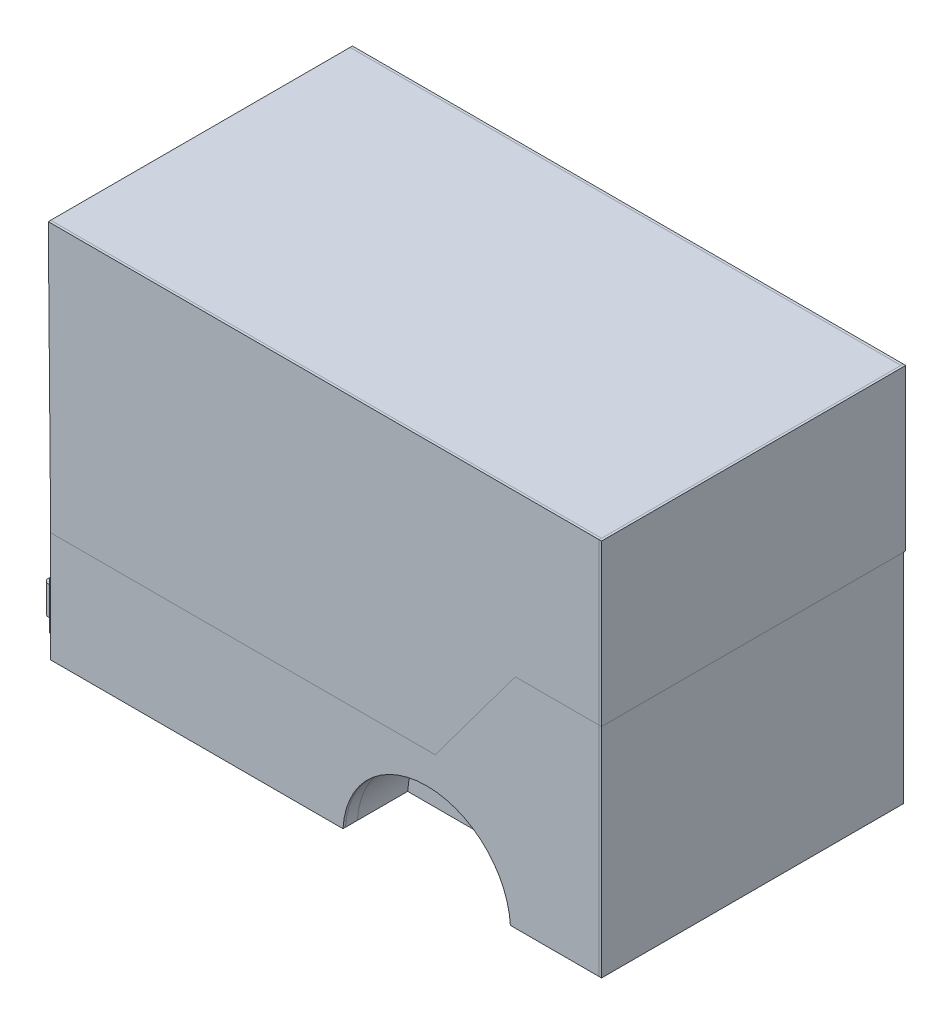
from build123d import *

# Parameters (mm, degrees)
SKETCH_1_W                = 229
SKETCH_1_H                = 125
EXTRUDE_1_DEPTH           = 88
SKETCH_4_W                = 125
SKETCH_4_H                = 88
SKETCH_4_W_2              = 123
SKETCH_4_H_2              = 86
CUT_EXTRUDE_3_DEPTH       = 1
SKETCH_5_W                = 125
SKETCH_5_H                = 88
EXTRUDE_2_DEPTH           = 1
SKETCH_11_W               = 5
SKETCH_11_H               = 20
EXTRUDE_3_DEPTH           = 2
SKETCH_12_R               = 2
EXTRUDE_4_DEPTH           = 12
SKETCH_13_R               = 35
CUT_EXTRUDE_7_DEPTH       = 26
CUT_EXTRUDE_START         = -26
SKETCH_14_R               = 35
CUT_EXTRUDE_8_DEPTH       = 26
SKETCH_16_W               = 229
SKETCH_16_H               = 125
EXTRUDE_6_DEPTH           = 70
SHELL_START               = -980.231317195
SHELL_1_OUTLINE_W         = 148
SHELL_1_OUTLINE_H         = 115
SHELL_1_DEPTH             = 113.617262665
SHELL_START_2             = -787.84857986
SHELL_1_2_OUTLINE_W       = 148
SHELL_1_2_OUTLINE_H       = 115
SHELL_1_2_DEPTH           = 31.617262665
SHELL_1_3_OUTLINE_W       = 3
SHELL_1_3_OUTLINE_H       = 63
SHELL_1_3_DEPTH           = 224
SHELL_START_3             = -981.231317195
SHELL_1_4_DEPTH           = 1
SHELL_START_4             = 7.020467364
SHELL_1_5_DEPTH           = 115
SHELL_START_5             = 33.020467364
SHELL_1_6_DEPTH           = 63
CUT_EXTRUDE_START_2       = -70
CUT_EXTRUDE_9_DEPTH       = 70
SKETCH_20_W               = 125
SKETCH_20_H               = 158
SKETCH_20_W_2             = 115
SKETCH_20_H_2             = 148
EXTRUDE_7_DEPTH           = 1
CUT_EXTRUDE_START_3       = -5
CUT_EXTRUDE_14_DEPTH      = 5
EXTRUDE_8_DEPTH           = 5
SKETCH_26_W               = 230
SKETCH_26_H               = 125
CUT_EXTRUDE_15_DEPTH      = 5
SKETCH_27_W               = 230
SKETCH_27_H               = 125
EXTRUDE_9_DEPTH           = 5
SKETCH_28_W               = 5
SKETCH_28_H               = 115
EXTRUDE_10_DEPTH          = 148
EXTRUDE_11_DEPTH          = 1
EXTRUDE_12_DEPTH          = 1
SKETCH_32_W               = 127
SKETCH_32_H               = 67.090624259
EXTRUDE_13_DEPTH          = 1
SKETCH_33_W               = 126
SKETCH_33_H               = 90.909375741
EXTRUDE_14_DEPTH          = 1
CUT_EXTRUDE_16_DEPTH      = 40
CUT_EXTRUDE_16_DEPTH_BACK = 10
SKETCH_34_W               = 225
SKETCH_34_H               = 5
SKETCH_35_W               = 220
SKETCH_35_H               = 153
EXTRUDE_16_DEPTH          = 5
SKETCH_36_W               = 5
SKETCH_36_H               = 153
EXTRUDE_17_DEPTH          = 5
CUT_EXTRUDE_17_DEPTH      = 5
SKETCH_39_W               = 115
SKETCH_39_H               = 5
CUT_EXTRUDE_18_DEPTH      = 5
SKETCH_40_W               = 5
SKETCH_40_H               = 120
EXTRUDE_19_DEPTH          = 153
SKETCH_45_W               = 78.76547467
SKETCH_45_H               = 26
EXTRUDE_21_DEPTH          = 33
CUT_EXTRUDE_20_DEPTH      = 21
SKETCH_48_R               = 34.912032086
CUT_EXTRUDE_21_DEPTH      = 21
SKETCH_49_W               = 106.382737335
SKETCH_49_H               = 26
EXTRUDE_22_DEPTH          = 40
SKETCH_50_W               = 78.76547467
SKETCH_50_H               = 33
CUT_EXTRUDE_23_DEPTH      = 26
SKETCH_52_W               = 20
SKETCH_52_H               = 20
EXTRUDE_23_DEPTH          = 55
SKETCH_53_W               = 106.382737335
SKETCH_53_H               = 53.625388161
EXTRUDE_24_DEPTH          = 5
SKETCH_54_W               = 100
SKETCH_54_H               = 56.25
EXTRUDE_25_DEPTH          = 1
SKETCH_55_W               = 110
SKETCH_55_H               = 66.25
SKETCH_55_W_2             = 100
SKETCH_55_H_2             = 56.25
EXTRUDE_26_DEPTH          = 2
SKETCH_58_W               = 20
SKETCH_58_H               = 20
EXTRUDE_28_DEPTH          = 70
FILLET_1_R                = 19
SKETCH_59_W               = 55
SKETCH_59_H               = 0.2
CUT_EXTRUDE_25_DEPTH      = 10
SKETCH_60_W               = 60
SKETCH_60_H               = 2
CUT_EXTRUDE_26_DEPTH      = 10
SKETCH_61_W               = 30
SKETCH_61_H               = 19
EXTRUDE_29_DEPTH          = 2
SKETCH_62_W               = 30
SKETCH_62_H               = 2
EXTRUDE_30_DEPTH          = 20
SKETCH_63_W               = 28
SKETCH_63_H               = 18
CUT_EXTRUDE_27_DEPTH      = 1
SKETCH_64_W               = 1.5
SKETCH_64_H               = 1.5
EXTRUDE_31_DEPTH          = 1
SKETCH_65_W               = 10
SKETCH_65_H               = 4.5
CUT_EXTRUDE_28_DEPTH      = 0.1
SKETCH_68_W               = 111.382737335
SKETCH_68_H               = 40
EXTRUDE_32_DEPTH          = 26
SKETCH_70_R               = 2.5
CUT_EXTRUDE_29_DEPTH      = 111.382737335
SKETCH_71_W               = 0.5
SKETCH_71_H               = 34.5
SKETCH_71_H_2             = 5.5
CUT_EXTRUDE_31_DEPTH      = 26
SKETCH_72_W               = 40
SKETCH_72_H               = 30
EXTRUDE_33_DEPTH          = 100
SKETCH_73_R               = 2
CUT_EXTRUDE_32_DEPTH      = 100
SKETCH_75_W               = 40
SKETCH_75_H               = 1
CUT_EXTRUDE_33_DEPTH      = 29
SKETCH_76_W               = 45
SKETCH_76_H               = 30
EXTRUDE_34_DEPTH          = 100
SKETCH_79_W               = 45
SKETCH_79_H               = 1
CUT_EXTRUDE_36_DEPTH      = 29
SKETCH_80_W               = 1
SKETCH_80_H               = 4
CUT_EXTRUDE_37_DEPTH      = 59
SKETCH_81_W               = 80
SKETCH_81_H               = 45
EXTRUDE_35_DEPTH          = 1
SKETCH_82_W               = 84
SKETCH_82_H               = 49
SKETCH_82_W_2             = 80
SKETCH_82_H_2             = 45
EXTRUDE_36_DEPTH          = 2


with BuildPart() as part:
    # 스케치1 → 보스-돌출1 (new body)
    with BuildSketch(Plane(origin=(0, 0, 0), x_dir=(1, 0, 0), z_dir=(0, 1, 0))):
        with Locations((-871.731317195, -64.520467364)):
            Rectangle(SKETCH_1_W, SKETCH_1_H)
    extrude(amount=EXTRUDE_1_DEPTH)

    # 스케치4 → 컷-돌출3 (cut)
    # profile 1 of 2: a face of its own
    with BuildSketch(Plane.ZY.offset(986.231317195)):
        with Locations((64.520467364, 44)):
            Rectangle(SKETCH_4_W, SKETCH_4_H)
        with Locations((64.520467364, 44)):
            Rectangle(SKETCH_4_W_2, SKETCH_4_H_2, mode=Mode.SUBTRACT)
    # profile 2 of 2: a face of its own
    with BuildSketch(Plane.ZY.offset(986.231317195)):
        with BuildLine():
            Line((6.020467364, 84), (6.020467364, 67.306026885))
            ThreePointArc((6.020467364, 67.306026885), (6.552613646, 56.95178287), (8.143444971, 46.70664722))
            Line((8.143444971, 46.70664722), (8.939528918, 42.885444272))
            ThreePointArc((8.939528918, 42.885444272), (10.498858633, 32.843182595), (11.020467364, 22.693973115))
            Line((11.020467364, 22.693973115), (11.020467364, 2))
            Line((11.020467364, 2), (118.020467364, 2))
            Line((118.020467364, 2), (118.020467364, 22.693973115))
            ThreePointArc((118.020467364, 22.693973115), (118.542076095, 32.843182595), (120.10140581, 42.885444272))
            Line((120.10140581, 42.885444272), (120.897489758, 46.70664722))
            ThreePointArc((120.897489758, 46.70664722), (122.488321083, 56.95178287), (123.020467364, 67.306026885))
            Line((123.020467364, 67.306026885), (123.020467364, 84))
            Line((123.020467364, 84), (6.020467364, 84))
        make_face()
        with BuildLine():
            Line((12.020467364, 22.693973115), (12.020467364, 3))
            Line((12.020467364, 3), (117.020467364, 3))
            Line((117.020467364, 3), (117.020467364, 22.693973115))
            ThreePointArc((117.020467364, 22.693973115), (117.547344871, 32.945699863), (119.122425391, 43.089398526))
            Line((119.122425391, 43.089398526), (119.918509338, 46.910601474))
            ThreePointArc((119.918509338, 46.910601474), (121.493589858, 57.054300137), (122.020467364, 67.306026885))
            Line((122.020467364, 67.306026885), (122.020467364, 83))
            Line((122.020467364, 83), (7.020467364, 83))
            Line((7.020467364, 83), (7.020467364, 67.306026885))
            ThreePointArc((7.020467364, 67.306026885), (7.547344871, 57.054300137), (9.122425391, 46.910601474))
            Line((9.122425391, 46.910601474), (9.918509338, 43.089398526))
            ThreePointArc((9.918509338, 43.089398526), (11.493589858, 32.945699863), (12.020467364, 22.693973115))
        make_face(mode=Mode.SUBTRACT)
    extrude(amount=-CUT_EXTRUDE_3_DEPTH, mode=Mode.SUBTRACT)

    # 스케치5 → 보스-돌출2 (add)
    with BuildSketch(Plane(origin=(-757.231317195, 0, 0), x_dir=(0, 0, -1), z_dir=(1, 0, 0))):
        with Locations((-64.520467364, 44)):
            Rectangle(SKETCH_5_W, SKETCH_5_H)
    extrude(amount=EXTRUDE_2_DEPTH)

    # 스케치13 → 컷-돌출7 (cut)
    with BuildSketch(Plane.XY.offset(127.020467364)):
        with Locations((-827.231317195, -2)):
            Circle(SKETCH_13_R)
    extrude(amount=-CUT_EXTRUDE_7_DEPTH, mode=Mode.SUBTRACT)

    # 스케치14 → 컷-돌출8 (cut)
    with BuildSketch(Plane(origin=(0, 0, 2.020467364), x_dir=(-1, 0, 0), z_dir=(0, 0, -1)).offset(CUT_EXTRUDE_START)):
        with Locations((827.231317195, -2)):
            Circle(SKETCH_14_R)
    extrude(amount=CUT_EXTRUDE_8_DEPTH, mode=Mode.SUBTRACT)

    # 스케치16 → 보스-돌출6 (add)
    with BuildSketch(Plane(origin=(0, 88, 0), x_dir=(1, 0, 0), z_dir=(0, 1, 0))):
        with Locations((-870.731317195, -64.520467364)):
            Rectangle(SKETCH_16_W, SKETCH_16_H)
    extrude(amount=EXTRUDE_6_DEPTH)

    # 쉘1: read off the stored shape, not the designer's step
    # 쉘1 outline → 쉘1 (cut)
    with BuildSketch(Plane.YZ.offset(SHELL_START)):
        with Locations((79, 64.520467364)):
            Rectangle(SHELL_1_OUTLINE_W, SHELL_1_OUTLINE_H)
    extrude(amount=SHELL_1_DEPTH, mode=Mode.SUBTRACT)

    # Shell 1 2 outline → Shell 1 2 (cut)
    with BuildSketch(Plane.YZ.offset(SHELL_START_2)):
        with Locations((79, 64.520467364)):
            Rectangle(SHELL_1_2_OUTLINE_W, SHELL_1_2_OUTLINE_H)
    extrude(amount=SHELL_1_2_DEPTH, mode=Mode.SUBTRACT)

    # Shell 1 3 outline → Shell 1 3 (cut)
    with BuildSketch(Plane.YZ.offset(SHELL_START)):
        with Locations((6.5, 64.520467364)):
            Rectangle(SHELL_1_3_OUTLINE_W, SHELL_1_3_OUTLINE_H)
    extrude(amount=SHELL_1_3_DEPTH, mode=Mode.SUBTRACT)

    # Shell 1 4 outline → Shell 1 4 (cut)
    with BuildSketch(Plane.YZ.offset(SHELL_START_3)):
        with BuildLine():
            Line((8, 96.020467364), (8, 33.020467364))
            Line((8, 33.020467364), (8, 17.020467364))
            Line((8, 17.020467364), (22.693973115, 17.020467364))
            ThreePointArc((22.693973115, 17.020467364), (33.4582862, 16.467245983), (44.109169797, 14.813411437))
            Line((44.109169797, 14.813411437), (47.930372745, 14.017327489))
            ThreePointArc((47.930372745, 14.017327489), (57.566886475, 12.521000995), (67.306026885, 12.020467364))
            Line((67.306026885, 12.020467364), (78, 12.020467364))
            Line((78, 12.020467364), (78, 117.020467364))
            Line((78, 117.020467364), (67.306026885, 117.020467364))
            ThreePointArc((67.306026885, 117.020467364), (57.566886475, 116.519933734), (47.930372745, 115.023607239))
            Line((47.930372745, 115.023607239), (44.109169797, 114.227523292))
            ThreePointArc((44.109169797, 114.227523292), (33.4582862, 112.573688746), (22.693973115, 112.020467364))
            Line((22.693973115, 112.020467364), (8, 112.020467364))
            Line((8, 112.020467364), (8, 96.020467364))
        make_face()
    extrude(amount=SHELL_1_4_DEPTH, mode=Mode.SUBTRACT)

    # Shell 1 5 outline → Shell 1 5 (cut)
    with BuildSketch(Plane.XY.offset(SHELL_START_4)):
        with BuildLine():
            Line((-787.84857986, 5), (-787.84857986, 153))
            Line((-787.84857986, 153), (-866.61405453, 153))
            Line((-866.61405453, 153), (-866.61405453, 5))
            ThreePointArc((-866.61405453, 5), (-827.231317195, 38), (-787.84857986, 5))
        make_face()
    extrude(amount=SHELL_1_5_DEPTH, mode=Mode.SUBTRACT)

    # Shell 1 6 outline → Shell 1 6 (cut)
    with BuildSketch(Plane.XY.offset(SHELL_START_5)):
        with BuildLine():
            Line((-865.961150657, 8), (-788.501483733, 8))
            ThreePointArc((-788.501483733, 8), (-827.231317195, 38), (-865.961150657, 8))
        make_face()
    extrude(amount=SHELL_1_6_DEPTH, mode=Mode.SUBTRACT)

    # 스케치18 → 컷-돌출9 (cut)
    with BuildSketch(Plane(origin=(-981.231317195, 0, 0), x_dir=(0, 0, -1), z_dir=(1, 0, 0)).offset(CUT_EXTRUDE_START_2)):
        with BuildLine():
            Line((-17.020467364, 8), (-17.020467364, 22.693973115))
            ThreePointArc((-17.020467364, 22.693973115), (-16.467245983, 33.4582862), (-14.813411437, 44.109169797))
            Line((-14.813411437, 44.109169797), (-14.017327489, 47.930372745))
            ThreePointArc((-14.017327489, 47.930372745), (-12.521000995, 57.566886475), (-12.020467364, 67.306026885))
            Line((-12.020467364, 67.306026885), (-12.020467364, 78))
            Line((-12.020467364, 78), (-117.020467364, 78))
            Line((-117.020467364, 78), (-117.020467364, 67.306026885))
            ThreePointArc((-117.020467364, 67.306026885), (-116.519933734, 57.566886475), (-115.023607239, 47.930372745))
            Line((-115.023607239, 47.930372745), (-114.227523292, 44.109169797))
            ThreePointArc((-114.227523292, 44.109169797), (-112.573688746, 33.4582862), (-112.020467364, 22.693973115))
            Line((-112.020467364, 22.693973115), (-112.020467364, 8))
            Line((-112.020467364, 8), (-17.020467364, 8))
        make_face()
    extrude(amount=CUT_EXTRUDE_9_DEPTH, mode=Mode.SUBTRACT)

    # 스케치20 → 보스-돌출7 (add)
    with BuildSketch(Plane(origin=(-756.231317195, 0, 0), x_dir=(0, 0, -1), z_dir=(1, 0, 0))):
        with Locations((-64.520467364, 79)):
            Rectangle(SKETCH_20_W, SKETCH_20_H)
        with Locations((-64.520467364, 79)):
            Rectangle(SKETCH_20_W_2, SKETCH_20_H_2, mode=Mode.SUBTRACT)
    extrude(amount=EXTRUDE_7_DEPTH)

    # 스케치24 → 컷-돌출14 (cut)
    with BuildSketch(Plane.XY.offset(127.020467364).offset(CUT_EXTRUDE_START_3)):
        with BuildLine():
            Line((-755.231317195, 153), (-980.231317195, 153))
            Line((-980.231317195, 153), (-980.231317195, 5))
            Line((-980.231317195, 5), (-866.61405453, 5))
            ThreePointArc((-866.61405453, 5), (-827.231317195, 38), (-787.84857986, 5))
            Line((-787.84857986, 5), (-755.231317195, 5))
            Line((-755.231317195, 5), (-755.231317195, 153))
        make_face()
    extrude(amount=CUT_EXTRUDE_14_DEPTH, mode=Mode.SUBTRACT)

    # 스케치26 → 컷-돌출15 (cut)
    with BuildSketch(Plane(origin=(0, 158, 0), x_dir=(1, 0, 0), z_dir=(0, 1, 0))):
        with Locations((-870.231317195, -64.520467364)):
            Rectangle(SKETCH_26_W, SKETCH_26_H)
    extrude(amount=-CUT_EXTRUDE_15_DEPTH, mode=Mode.SUBTRACT)

    # 스케치34 → 컷-돌출16 (cut, two sides: drawn at the far end of the back side and taken through both)
    with BuildSketch(Plane(origin=(0, 5, 0), x_dir=(1, 0, 0), z_dir=(0, 1, 0)).offset(-CUT_EXTRUDE_16_DEPTH_BACK)):
        with Locations((-867.731317195, -124.520467364)):
            Rectangle(SKETCH_34_W, SKETCH_34_H)
    extrude(amount=CUT_EXTRUDE_16_DEPTH + CUT_EXTRUDE_16_DEPTH_BACK, mode=Mode.SUBTRACT)

    # 스케치39 → 컷-돌출18 (cut)
    with BuildSketch(Plane(origin=(-755.231317195, 0, 0), x_dir=(0, 0, -1), z_dir=(1, 0, 0))):
        with Locations((-64.520467364, 2.5)):
            Rectangle(SKETCH_39_W, SKETCH_39_H)
    extrude(amount=-CUT_EXTRUDE_18_DEPTH, mode=Mode.SUBTRACT)

    # 스케치45 → 보스-돌출21 (add)
    with BuildSketch(Plane(origin=(0, 5, 0), x_dir=(1, 0, 0), z_dir=(0, 1, 0))):
        with Locations((-827.231317195, -20.020467364)):
            Rectangle(SKETCH_45_W, SKETCH_45_H)
        with Locations((-827.231317195, -109.020467364)):
            Rectangle(SKETCH_45_W, SKETCH_45_H)
    extrude(amount=EXTRUDE_21_DEPTH)

    # 스케치47 → 컷-돌출20 (cut)
    with BuildSketch(Plane.XY.offset(122.020467364)):
        with BuildLine():
            Line((-862.174127614, 0), (-792.288506775, 0))
            ThreePointArc((-792.288506775, 0), (-827.231317195, 33), (-862.174127614, 0))
        make_face()
    extrude(amount=-CUT_EXTRUDE_20_DEPTH, mode=Mode.SUBTRACT)

    # 스케치48 → 컷-돌출21 (cut)
    with BuildSketch(Plane(origin=(0, 0, 7.020467364), x_dir=(-1, 0, 0), z_dir=(0, 0, -1))):
        with Locations((827.252311569, -1.914574066)):
            Circle(SKETCH_48_R)
    extrude(amount=-CUT_EXTRUDE_21_DEPTH, mode=Mode.SUBTRACT)


with BuildPart() as body_2:
    # 스케치11 → 보스-돌출3 (new body)
    with BuildSketch(Plane.ZY.offset(986.231317195)):
        with Locations((122.020467364, 16)):
            Rectangle(SKETCH_11_W, SKETCH_11_H)
    extrude(amount=EXTRUDE_3_DEPTH)

    # 스케치12 → 보스-돌출4 (add)
    with BuildSketch(Plane(origin=(0, 23, 0), x_dir=(1, 0, 0), z_dir=(0, 1, 0))):
        with Locations((-989.231317195, -122.020467364)):
            Circle(SKETCH_12_R)
    extrude(amount=-EXTRUDE_4_DEPTH)


with BuildPart() as body_3:
    # 대칭 복사1: mirrored copy
    add(body_2.part.mirror(Plane.XY.offset(64.520467364)))


with BuildPart() as body_4:
    # 스케치25 → 보스-돌출8 (new body)
    with BuildSketch(Plane.XY.offset(127.020467364)):
        with BuildLine():
            Line((-980.231317195, 153), (-755.231317195, 153))
            Line((-755.231317195, 153), (-755.231317195, 5))
            Line((-755.231317195, 5), (-787.616277727, 5))
            ThreePointArc((-787.616277727, 5), (-826.999015062, 38), (-866.381752397, 5))
            Line((-866.381752397, 5), (-980.231317195, 5))
            Line((-980.231317195, 5), (-980.231317195, 153))
        make_face()
    extrude(amount=-EXTRUDE_8_DEPTH)


with BuildPart() as body_5:
    # 스케치27 → 보스-돌출9 (new body)
    with BuildSketch(Plane(origin=(0, 153, 0), x_dir=(1, 0, 0), z_dir=(0, 1, 0))):
        with Locations((-870.231317195, -64.520467364)):
            Rectangle(SKETCH_27_W, SKETCH_27_H)
    extrude(amount=EXTRUDE_9_DEPTH)


with BuildPart() as body_6:
    # 스케치28 → 보스-돌출10 (new body)
    with BuildSketch(Plane(origin=(0, 5, 0), x_dir=(1, 0, 0), z_dir=(0, 1, 0))):
        with Locations((-757.731317195, -64.520467364)):
            Rectangle(SKETCH_28_W, SKETCH_28_H)
    extrude(amount=EXTRUDE_10_DEPTH)


with BuildPart() as body_7:
    # 스케치29 → 보스-돌출11 (new body)
    with BuildSketch(Plane(origin=(0, 0, 2.020467364), x_dir=(-1, 0, 0), z_dir=(0, 0, -1))):
        with BuildLine():
            Line((984.231317195, 0), (984.231317195, 46))
            Line((984.231317195, 46), (823.655113572, 46))
            Line((823.655113572, 46), (790.231317195, 90.909375741))
            Line((790.231317195, 90.909375741), (755.231317195, 90.909375741))
            Line((755.231317195, 90.909375741), (755.231317195, 0))
            Line((755.231317195, 0), (792.288506775, 0))
            ThreePointArc((792.288506775, 0), (827.231317195, 33), (862.174127614, 0))
            Line((862.174127614, 0), (984.231317195, 0))
        make_face()
    extrude(amount=EXTRUDE_11_DEPTH)


with BuildPart() as body_8:
    # 스케치30 → 보스-돌출12 (new body)
    with BuildSketch(Plane(origin=(0, 0, 2.020467364), x_dir=(-1, 0, 0), z_dir=(0, 0, -1))):
        Polygon((755.231317195, 90.909375741), (755.231317195, 158), (985.231317195, 158), (984.231317195, 46), (823.655113572, 46), (790.231317195, 90.909375741), align=None)
    extrude(amount=EXTRUDE_12_DEPTH)


with BuildPart() as body_8_2:
    # 대칭 복사3: mirrored copy
    add(body_8.part.mirror(Plane.XY.offset(64.520467364)))


with BuildPart() as body_9:
    # Mirror 3 2: mirrored copy
    add(body_7.part.mirror(Plane.XY.offset(64.520467364)))


with BuildPart() as body_10:
    # 스케치32 → 보스-돌출13 (new body)
    with BuildSketch(Plane(origin=(-755.231317195, 0, 0), x_dir=(0, 0, -1), z_dir=(1, 0, 0))):
        with Locations((-64.520467364, 124.454687871)):
            Rectangle(SKETCH_32_W, SKETCH_32_H)
    extrude(amount=EXTRUDE_13_DEPTH)


with BuildPart() as body_11:
    # 스케치33 → 보스-돌출14 (new body)
    with BuildSketch(Plane(origin=(-755.231317195, 0, 0), x_dir=(0, 0, -1), z_dir=(1, 0, 0))):
        with Locations((-65.020467364, 45.454687871)):
            Rectangle(SKETCH_33_W, SKETCH_33_H)
    extrude(amount=EXTRUDE_14_DEPTH)


with BuildPart() as body_12:
    # 대칭 복사4: mirrored copy
    add(body_2.part.mirror(Plane.XY.offset(64.520467364)))


with BuildPart() as body_12_2:
    # 스케치35 → 보스-돌출16 (new body)
    with BuildSketch(Plane.XY.offset(122.020467364)):
        with Locations((-870.231317195, 76.5)):
            Rectangle(SKETCH_35_W, SKETCH_35_H)
    extrude(amount=EXTRUDE_16_DEPTH)

    # 스케치36 → 보스-돌출17 (add)
    with BuildSketch(Plane(origin=(-760.231317195, 0, 0), x_dir=(0, 0, -1), z_dir=(1, 0, 0))):
        with Locations((-124.520467364, 76.5)):
            Rectangle(SKETCH_36_W, SKETCH_36_H)
    extrude(amount=EXTRUDE_17_DEPTH)

    # 스케치37 → 컷-돌출17 (cut)
    with BuildSketch(Plane.XY.offset(127.020467364)):
        with BuildLine():
            Line((-862.174127614, 0), (-792.288506775, 0))
            ThreePointArc((-792.288506775, 0), (-827.231317195, 33), (-862.174127614, 0))
        make_face()
    extrude(amount=-CUT_EXTRUDE_17_DEPTH, mode=Mode.SUBTRACT)


with BuildPart() as body_12_3:
    # 스케치40 → 보스-돌출19 (new body)
    with BuildSketch(Plane.XZ):
        with Locations((-757.731317195, 67.020467364)):
            Rectangle(SKETCH_40_W, SKETCH_40_H)
    extrude(amount=-EXTRUDE_19_DEPTH)


with BuildPart() as body_13:
    # 스케치49 → 보스-돌출22 (new body)
    with BuildSketch(Plane(origin=(0, 5, 0), x_dir=(1, 0, 0), z_dir=(0, 1, 0))):
        with Locations((-813.422685863, -109.020467364)):
            Rectangle(SKETCH_49_W, SKETCH_49_H)
    extrude(amount=EXTRUDE_22_DEPTH)

    # 스케치50 → 컷-돌출23 (cut)
    with BuildSketch(Plane.XY.offset(122.020467364)):
        with Locations((-827.231317195, 21.5)):
            Rectangle(SKETCH_50_W, SKETCH_50_H)
    extrude(amount=-CUT_EXTRUDE_23_DEPTH, mode=Mode.SUBTRACT)


with BuildPart() as body_14:
    # 대칭 복사5: mirrored copy
    add(body_13.part.mirror(Plane.XY.offset(64.520467364)))


with BuildPart() as body_15:
    # 스케치52 → 보스-돌출23 (new body)
    with BuildSketch(Plane(origin=(0, 5, 0), x_dir=(1, 0, 0), z_dir=(0, 1, 0))):
        with Locations((-813.422685862, -64.520467364)):
            Rectangle(SKETCH_52_W, SKETCH_52_H)
    extrude(amount=EXTRUDE_23_DEPTH)

    # 스케치53 → 보스-돌출24 (add)
    with BuildSketch(Plane(origin=(0, 60, 0), x_dir=(1, 0, 0), z_dir=(0, 1, 0))):
        with Locations((-813.422685863, -64.520467365)):
            Rectangle(SKETCH_53_W, SKETCH_53_H)
    extrude(amount=EXTRUDE_24_DEPTH)


with BuildPart() as body_16:
    # 스케치54 → 보스-돌출25 (new body)
    with BuildSketch(Plane(origin=(-980.231317195, 0, 0), x_dir=(0, 0, -1), z_dir=(1, 0, 0))):
        with Locations((-67.020467364, 115.5)):
            Rectangle(SKETCH_54_W, SKETCH_54_H)
    extrude(amount=EXTRUDE_25_DEPTH)


with BuildPart() as body_17:
    # 스케치55 → 보스-돌출26 (new body)
    with BuildSketch(Plane(origin=(-979.231317195, 0, 0), x_dir=(0, 0, -1), z_dir=(1, 0, 0))):
        with Locations((-67.020467364, 115.5)):
            Rectangle(SKETCH_55_W, SKETCH_55_H)
        with Locations((-67.020467364, 115.5)):
            Rectangle(SKETCH_55_W_2, SKETCH_55_H_2, mode=Mode.SUBTRACT)
    extrude(amount=EXTRUDE_26_DEPTH)


with BuildPart() as body_18:
    # 스케치58 → 보스-돌출28 (new body)
    with BuildSketch(Plane(origin=(-972.231317195, 0, 0), x_dir=(0, 0, -1), z_dir=(1, 0, 0))):
        with Locations((-17.020467364, 134.236109848)):
            Rectangle(SKETCH_58_W, SKETCH_58_H)
    extrude(amount=EXTRUDE_28_DEPTH)

    # 필렛1
    fillet_1_edges = [body_18.edges().sort_by_distance(p)[0] for p in [
        (-937.231317195, 124.236109848, 27.020467364),
    ]]
    fillet(fillet_1_edges, radius=FILLET_1_R)

    # 스케치59 → 컷-돌출25 (cut)
    with BuildSketch(Plane.XZ.offset(-124.236109848)):
        with Locations((-942.231317195, 8.765783167)):
            Rectangle(SKETCH_59_W, SKETCH_59_H)
        with Locations((-942.231317195, 9.065783167)):
            Rectangle(SKETCH_59_W, SKETCH_59_H)
        with Locations((-942.231317195, 9.365783167)):
            Rectangle(SKETCH_59_W, SKETCH_59_H)
        with Locations((-942.231317195, 9.665783167)):
            Rectangle(SKETCH_59_W, SKETCH_59_H)
        with Locations((-942.231317195, 9.965783167)):
            Rectangle(SKETCH_59_W, SKETCH_59_H)
        with Locations((-942.231317195, 10.265783167)):
            Rectangle(SKETCH_59_W, SKETCH_59_H)
        with Locations((-942.231317195, 10.565783167)):
            Rectangle(SKETCH_59_W, SKETCH_59_H)
        with Locations((-942.231317195, 10.865783167)):
            Rectangle(SKETCH_59_W, SKETCH_59_H)
        with Locations((-942.231317195, 11.165783167)):
            Rectangle(SKETCH_59_W, SKETCH_59_H)
        with Locations((-942.231317195, 11.465783167)):
            Rectangle(SKETCH_59_W, SKETCH_59_H)
        with Locations((-942.231317195, 11.765783167)):
            Rectangle(SKETCH_59_W, SKETCH_59_H)
        with Locations((-942.231317195, 12.065783167)):
            Rectangle(SKETCH_59_W, SKETCH_59_H)
        with Locations((-942.231317195, 12.365783167)):
            Rectangle(SKETCH_59_W, SKETCH_59_H)
        with Locations((-942.231317195, 12.665783167)):
            Rectangle(SKETCH_59_W, SKETCH_59_H)
        with Locations((-942.231317195, 12.965783167)):
            Rectangle(SKETCH_59_W, SKETCH_59_H)
        with Locations((-942.231317195, 13.265783167)):
            Rectangle(SKETCH_59_W, SKETCH_59_H)
        with Locations((-942.231317195, 13.565783167)):
            Rectangle(SKETCH_59_W, SKETCH_59_H)
        with Locations((-942.231317195, 13.865783167)):
            Rectangle(SKETCH_59_W, SKETCH_59_H)
        with Locations((-942.231317195, 14.165783167)):
            Rectangle(SKETCH_59_W, SKETCH_59_H)
        with Locations((-942.231317195, 14.465783167)):
            Rectangle(SKETCH_59_W, SKETCH_59_H)
        with Locations((-942.231317195, 14.765783167)):
            Rectangle(SKETCH_59_W, SKETCH_59_H)
        with Locations((-942.231317195, 15.065783167)):
            Rectangle(SKETCH_59_W, SKETCH_59_H)
        with Locations((-942.231317195, 15.365783167)):
            Rectangle(SKETCH_59_W, SKETCH_59_H)
        with Locations((-942.231317195, 15.665783167)):
            Rectangle(SKETCH_59_W, SKETCH_59_H)
        with Locations((-942.231317195, 15.965783167)):
            Rectangle(SKETCH_59_W, SKETCH_59_H)
        with Locations((-942.231317195, 16.265783167)):
            Rectangle(SKETCH_59_W, SKETCH_59_H)
        with Locations((-942.231317195, 16.565783167)):
            Rectangle(SKETCH_59_W, SKETCH_59_H)
        with Locations((-942.231317195, 16.865783167)):
            Rectangle(SKETCH_59_W, SKETCH_59_H)
        with Locations((-942.231317195, 17.165783167)):
            Rectangle(SKETCH_59_W, SKETCH_59_H)
        with Locations((-942.231317195, 17.465783167)):
            Rectangle(SKETCH_59_W, SKETCH_59_H)
        with Locations((-942.231317195, 17.765783167)):
            Rectangle(SKETCH_59_W, SKETCH_59_H)
        with Locations((-942.231317195, 18.065783167)):
            Rectangle(SKETCH_59_W, SKETCH_59_H)
        with Locations((-942.231317195, 18.365783167)):
            Rectangle(SKETCH_59_W, SKETCH_59_H)
        with Locations((-942.231317195, 18.665783167)):
            Rectangle(SKETCH_59_W, SKETCH_59_H)
        with Locations((-942.231317195, 18.965783167)):
            Rectangle(SKETCH_59_W, SKETCH_59_H)
        with Locations((-942.231317195, 19.265783167)):
            Rectangle(SKETCH_59_W, SKETCH_59_H)
        with Locations((-942.231317195, 19.565783167)):
            Rectangle(SKETCH_59_W, SKETCH_59_H)
        with Locations((-942.231317195, 19.865783167)):
            Rectangle(SKETCH_59_W, SKETCH_59_H)
        with Locations((-942.231317195, 20.165783167)):
            Rectangle(SKETCH_59_W, SKETCH_59_H)
        with Locations((-942.231317195, 20.465783167)):
            Rectangle(SKETCH_59_W, SKETCH_59_H)
    extrude(amount=-CUT_EXTRUDE_25_DEPTH, mode=Mode.SUBTRACT)

    # 스케치60 → 컷-돌출26 (cut)
    with BuildSketch(Plane(origin=(0, 144.236109848, 0), x_dir=(1, 0, 0), z_dir=(0, 1, 0))):
        with Locations((-937.231317195, -10.168549835)):
            Rectangle(SKETCH_60_W, SKETCH_60_H)
        with Locations((-937.231317195, -13.168549835)):
            Rectangle(SKETCH_60_W, SKETCH_60_H)
        with Locations((-937.231317195, -16.168549835)):
            Rectangle(SKETCH_60_W, SKETCH_60_H)
        with Locations((-937.231317195, -19.168549835)):
            Rectangle(SKETCH_60_W, SKETCH_60_H)
    extrude(amount=-CUT_EXTRUDE_26_DEPTH, mode=Mode.SUBTRACT)


with BuildPart() as body_19:
    # 스케치61 → 보스-돌출29 (new body)
    with BuildSketch(Plane(origin=(0, 65, 0), x_dir=(1, 0, 0), z_dir=(0, 1, 0))):
        with Locations((-841.61405453, -77.234878482)):
            Rectangle(SKETCH_61_W, SKETCH_61_H)
    extrude(amount=EXTRUDE_29_DEPTH)

    # 스케치62 → 보스-돌출30 (add)
    with BuildSketch(Plane(origin=(0, 67, 0), x_dir=(1, 0, 0), z_dir=(0, 1, 0))):
        with Locations((-841.61405453, -68.734878482)):
            Rectangle(SKETCH_62_W, SKETCH_62_H)
    extrude(amount=EXTRUDE_30_DEPTH)

    # 스케치63 → 컷-돌출27 (cut)
    with BuildSketch(Plane.XY.offset(69.734878482)):
        with Locations((-841.61405453, 77)):
            Rectangle(SKETCH_63_W, SKETCH_63_H)
    extrude(amount=-CUT_EXTRUDE_27_DEPTH, mode=Mode.SUBTRACT)

    # 스케치64 → 보스-돌출31 (add)
    with BuildSketch(Plane(origin=(0, 67, 0), x_dir=(1, 0, 0), z_dir=(0, 1, 0))):
        with Locations((-853.86405453, -74.046732329)):
            Rectangle(SKETCH_64_W, SKETCH_64_H)
        with Locations((-851.86405453, -74.046732329)):
            Rectangle(SKETCH_64_W, SKETCH_64_H)
        with Locations((-849.86405453, -74.046732329)):
            Rectangle(SKETCH_64_W, SKETCH_64_H)
        with Locations((-847.86405453, -74.046732329)):
            Rectangle(SKETCH_64_W, SKETCH_64_H)
        with Locations((-845.86405453, -74.046732329)):
            Rectangle(SKETCH_64_W, SKETCH_64_H)
        with Locations((-843.86405453, -74.046732329)):
            Rectangle(SKETCH_64_W, SKETCH_64_H)
        with Locations((-841.86405453, -74.046732329)):
            Rectangle(SKETCH_64_W, SKETCH_64_H)
        with Locations((-839.86405453, -74.046732329)):
            Rectangle(SKETCH_64_W, SKETCH_64_H)
        with Locations((-837.86405453, -74.046732329)):
            Rectangle(SKETCH_64_W, SKETCH_64_H)
        with Locations((-835.86405453, -74.046732329)):
            Rectangle(SKETCH_64_W, SKETCH_64_H)
        with Locations((-833.86405453, -74.046732329)):
            Rectangle(SKETCH_64_W, SKETCH_64_H)
        with Locations((-831.86405453, -74.046732329)):
            Rectangle(SKETCH_64_W, SKETCH_64_H)
        with Locations((-829.86405453, -74.046732329)):
            Rectangle(SKETCH_64_W, SKETCH_64_H)
        with Locations((-850.86405453, -76.046732329)):
            Rectangle(SKETCH_64_W, SKETCH_64_H)
        with Locations((-852.86405453, -76.046732329)):
            Rectangle(SKETCH_64_W, SKETCH_64_H)
        with Locations((-848.86405453, -76.046732329)):
            Rectangle(SKETCH_64_W, SKETCH_64_H)
        with Locations((-846.86405453, -76.046732329)):
            Rectangle(SKETCH_64_W, SKETCH_64_H)
        with Locations((-844.86405453, -76.046732329)):
            Rectangle(SKETCH_64_W, SKETCH_64_H)
        with Locations((-842.86405453, -76.046732329)):
            Rectangle(SKETCH_64_W, SKETCH_64_H)
        with Locations((-840.86405453, -76.046732329)):
            Rectangle(SKETCH_64_W, SKETCH_64_H)
        with Locations((-838.86405453, -76.046732329)):
            Rectangle(SKETCH_64_W, SKETCH_64_H)
        with Locations((-836.86405453, -76.046732329)):
            Rectangle(SKETCH_64_W, SKETCH_64_H)
        with Locations((-834.86405453, -76.046732329)):
            Rectangle(SKETCH_64_W, SKETCH_64_H)
        with Locations((-832.86405453, -76.046732329)):
            Rectangle(SKETCH_64_W, SKETCH_64_H)
        with Locations((-830.86405453, -76.046732329)):
            Rectangle(SKETCH_64_W, SKETCH_64_H)
        with Locations((-853.86405453, -78.046732329)):
            Rectangle(SKETCH_64_W, SKETCH_64_H)
        with Locations((-851.86405453, -78.046732329)):
            Rectangle(SKETCH_64_W, SKETCH_64_H)
        with Locations((-849.86405453, -78.046732329)):
            Rectangle(SKETCH_64_W, SKETCH_64_H)
        with Locations((-847.86405453, -78.046732329)):
            Rectangle(SKETCH_64_W, SKETCH_64_H)
        with Locations((-845.86405453, -78.046732329)):
            Rectangle(SKETCH_64_W, SKETCH_64_H)
        with Locations((-843.86405453, -78.046732329)):
            Rectangle(SKETCH_64_W, SKETCH_64_H)
        with Locations((-841.86405453, -78.046732329)):
            Rectangle(SKETCH_64_W, SKETCH_64_H)
        with Locations((-839.86405453, -78.046732329)):
            Rectangle(SKETCH_64_W, SKETCH_64_H)
        with Locations((-837.86405453, -78.046732329)):
            Rectangle(SKETCH_64_W, SKETCH_64_H)
        with Locations((-835.86405453, -78.046732329)):
            Rectangle(SKETCH_64_W, SKETCH_64_H)
        with Locations((-833.86405453, -78.046732329)):
            Rectangle(SKETCH_64_W, SKETCH_64_H)
        with Locations((-831.86405453, -78.046732329)):
            Rectangle(SKETCH_64_W, SKETCH_64_H)
        with Locations((-829.86405453, -78.046732329)):
            Rectangle(SKETCH_64_W, SKETCH_64_H)
        with Locations((-850.86405453, -80.046732329)):
            Rectangle(SKETCH_64_W, SKETCH_64_H)
        with Locations((-852.86405453, -80.046732329)):
            Rectangle(SKETCH_64_W, SKETCH_64_H)
        with Locations((-848.86405453, -80.046732329)):
            Rectangle(SKETCH_64_W, SKETCH_64_H)
        with Locations((-846.86405453, -80.046732329)):
            Rectangle(SKETCH_64_W, SKETCH_64_H)
        with Locations((-844.86405453, -80.046732329)):
            Rectangle(SKETCH_64_W, SKETCH_64_H)
        with Locations((-842.86405453, -80.046732329)):
            Rectangle(SKETCH_64_W, SKETCH_64_H)
        with Locations((-840.86405453, -80.046732329)):
            Rectangle(SKETCH_64_W, SKETCH_64_H)
        with Locations((-838.86405453, -80.046732329)):
            Rectangle(SKETCH_64_W, SKETCH_64_H)
        with Locations((-836.86405453, -80.046732329)):
            Rectangle(SKETCH_64_W, SKETCH_64_H)
        with Locations((-834.86405453, -80.046732329)):
            Rectangle(SKETCH_64_W, SKETCH_64_H)
        with Locations((-832.86405453, -80.046732329)):
            Rectangle(SKETCH_64_W, SKETCH_64_H)
        with Locations((-830.86405453, -80.046732329)):
            Rectangle(SKETCH_64_W, SKETCH_64_H)
    extrude(amount=EXTRUDE_31_DEPTH)

    # 스케치65 → 컷-돌출28 (cut)
    with BuildSketch(Plane(origin=(0, 67, 0), x_dir=(1, 0, 0), z_dir=(0, 1, 0))):
        with Locations((-841.61405453, -83.765805406)):
            Rectangle(SKETCH_65_W, SKETCH_65_H)
    extrude(amount=-CUT_EXTRUDE_28_DEPTH, mode=Mode.SUBTRACT)


with BuildPart() as body_20:
    # 대칭 복사6: mirrored copy
    add(body_19.part.mirror(Plane.ZY.offset(813.42405453)))


with BuildPart() as body_21:
    # 대칭 복사7: mirrored copy
    add(body_19.part.mirror(Plane(origin=(0, 0, 64.522773284), x_dir=(1, 0, 0), z_dir=(0, 0, -1))))


with BuildPart() as body_22:
    # Mirror 7 2: mirrored copy
    add(body_20.part.mirror(Plane(origin=(0, 0, 64.522773284), x_dir=(1, 0, 0), z_dir=(0, 0, -1))))


with BuildPart() as body_23:
    # 스케치68 → 보스-돌출32 (new body)
    with BuildSketch(Plane.XY.offset(7.020467364)):
        with Locations((-810.922685863, 133)):
            Rectangle(SKETCH_68_W, SKETCH_68_H)
    extrude(amount=EXTRUDE_32_DEPTH)

    # 스케치70 → 컷-돌출29 (cut)
    with BuildSketch(Plane(origin=(-755.231317195, 0, 0), x_dir=(0, 0, -1), z_dir=(1, 0, 0))):
        with Locations((-33.020467364, 116)):
            Circle(SKETCH_70_R)
    extrude(amount=-CUT_EXTRUDE_29_DEPTH, mode=Mode.SUBTRACT)

    # 스케치71 → 컷-돌출31 (cut)
    with BuildSketch(Plane.XY.offset(33.020467364)):
        with Locations((-839.01905453, 135.75)):
            Rectangle(SKETCH_71_W, SKETCH_71_H)
        with Locations((-838.51905453, 135.75)):
            Rectangle(SKETCH_71_W, SKETCH_71_H)
        with Locations((-839.01905453, 115.75)):
            Rectangle(SKETCH_71_W, SKETCH_71_H_2)
        with Locations((-838.51905453, 115.75)):
            Rectangle(SKETCH_71_W, SKETCH_71_H_2)
        with Locations((-811.16905453, 135.75)):
            Rectangle(SKETCH_71_W, SKETCH_71_H)
        with Locations((-810.66905453, 135.75)):
            Rectangle(SKETCH_71_W, SKETCH_71_H)
        with Locations((-811.16905453, 115.75)):
            Rectangle(SKETCH_71_W, SKETCH_71_H_2)
        with Locations((-810.66905453, 115.75)):
            Rectangle(SKETCH_71_W, SKETCH_71_H_2)
        with Locations((-783.31905453, 135.75)):
            Rectangle(SKETCH_71_W, SKETCH_71_H)
        with Locations((-782.81905453, 135.75)):
            Rectangle(SKETCH_71_W, SKETCH_71_H)
        with Locations((-783.31905453, 115.75)):
            Rectangle(SKETCH_71_W, SKETCH_71_H_2)
        with Locations((-782.81905453, 115.75)):
            Rectangle(SKETCH_71_W, SKETCH_71_H_2)
    extrude(amount=-CUT_EXTRUDE_31_DEPTH, mode=Mode.SUBTRACT)


with BuildPart() as cut_extrude_31_piece_1:
    # of the separate pieces the step leaves, piece 1, a body of its own (cut_extrude_31_pieces)
    add(body_23.part.solids().sort_by_distance((-839.26905453, 153, 7.020467364))[0])


with BuildPart() as cut_extrude_31_piece_2:
    # of the separate pieces the step leaves, piece 2, a body of its own (cut_extrude_31_pieces)
    add(body_23.part.solids().sort_by_distance((-755.231317195, 153, 7.020467364))[0])


with BuildPart() as cut_extrude_31_piece_3:
    # of the separate pieces the step leaves, piece 3, a body of its own (cut_extrude_31_pieces)
    add(body_23.part.solids().sort_by_distance((-811.41905453, 153, 7.020467364))[0])


with BuildPart() as cut_extrude_31_piece_4:
    # of the separate pieces the step leaves, piece 4, a body of its own (cut_extrude_31_pieces)
    add(body_23.part.solids().sort_by_distance((-783.56905453, 153, 7.020467364))[0])


with BuildPart() as body_27:
    # 스케치72 → 보스-돌출33 (new body)
    with BuildSketch(Plane(origin=(0, 5, 0), x_dir=(1, 0, 0), z_dir=(0, 1, 0))):
        with Locations((-948.973273422, -22.020467364)):
            Rectangle(SKETCH_72_W, SKETCH_72_H)
    extrude(amount=EXTRUDE_33_DEPTH)

    # 스케치73 → 컷-돌출32 (cut)
    with BuildSketch(Plane(origin=(0, 105, 0), x_dir=(1, 0, 0), z_dir=(0, 1, 0))):
        with Locations((-932.718829564, -37.020467364)):
            Circle(SKETCH_73_R)
    extrude(amount=-CUT_EXTRUDE_32_DEPTH, mode=Mode.SUBTRACT)

    # 스케치75 → 컷-돌출33 (cut)
    with BuildSketch(Plane.XY.offset(37.020467364)):
        with Locations((-948.973273422, 69.5)):
            Rectangle(SKETCH_75_W, SKETCH_75_H)
    extrude(amount=-CUT_EXTRUDE_33_DEPTH, mode=Mode.SUBTRACT)


with BuildPart() as body_28:
    # 스케치76 → 보스-돌출34 (new body)
    with BuildSketch(Plane(origin=(0, 5, 0), x_dir=(1, 0, 0), z_dir=(0, 1, 0))):
        with Locations((-899.11405453, -22.020467364)):
            Rectangle(SKETCH_76_W, SKETCH_76_H)
    extrude(amount=EXTRUDE_34_DEPTH)

    # 스케치79 → 컷-돌출36 (cut)
    with BuildSketch(Plane.XY.offset(37.020467364)):
        with Locations((-899.11405453, 45.5)):
            Rectangle(SKETCH_79_W, SKETCH_79_H)
        with Locations((-899.11405453, 25.5)):
            Rectangle(SKETCH_79_W, SKETCH_79_H)
    extrude(amount=-CUT_EXTRUDE_36_DEPTH, mode=Mode.SUBTRACT)

    # 스케치80 → 컷-돌출37 (cut)
    with BuildSketch(Plane(origin=(0, 105, 0), x_dir=(1, 0, 0), z_dir=(0, 1, 0))):
        with Locations((-899.11405453, -37.020467364)):
            Rectangle(SKETCH_80_W, SKETCH_80_H)
    extrude(amount=-CUT_EXTRUDE_37_DEPTH, mode=Mode.SUBTRACT)


with BuildPart() as body_29:
    # 스케치81 → 보스-돌출35 (new body)
    with BuildSketch(Plane(origin=(-980.231317195, 0, 0), x_dir=(0, 0, -1), z_dir=(1, 0, 0))):
        with Locations((-80.020467364, 115.5)):
            Rectangle(SKETCH_81_W, SKETCH_81_H)
    extrude(amount=EXTRUDE_35_DEPTH)

    # 스케치82 → 보스-돌출36 (add)
    with BuildSketch(Plane(origin=(-980.231317195, 0, 0), x_dir=(0, 0, -1), z_dir=(1, 0, 0))):
        with Locations((-80.020467364, 115.5)):
            Rectangle(SKETCH_82_W, SKETCH_82_H)
        with Locations((-80.020467364, 115.5)):
            Rectangle(SKETCH_82_W_2, SKETCH_82_H_2, mode=Mode.SUBTRACT)
    extrude(amount=EXTRUDE_36_DEPTH)


solid = Compound([part.part, body_2.part, body_5.part, body_7.part, body_8.part, body_8_2.part, body_9.part, body_10.part, body_11.part, body_12.part, body_12_2.part, body_12_3.part, body_13.part, body_14.part, body_15.part, body_16.part, body_17.part, body_18.part, body_19.part, body_20.part, body_21.part, body_22.part, cut_extrude_31_piece_1.part, cut_extrude_31_piece_2.part, cut_extrude_31_piece_3.part, cut_extrude_31_piece_4.part, body_27.part, body_28.part, body_29.part])
